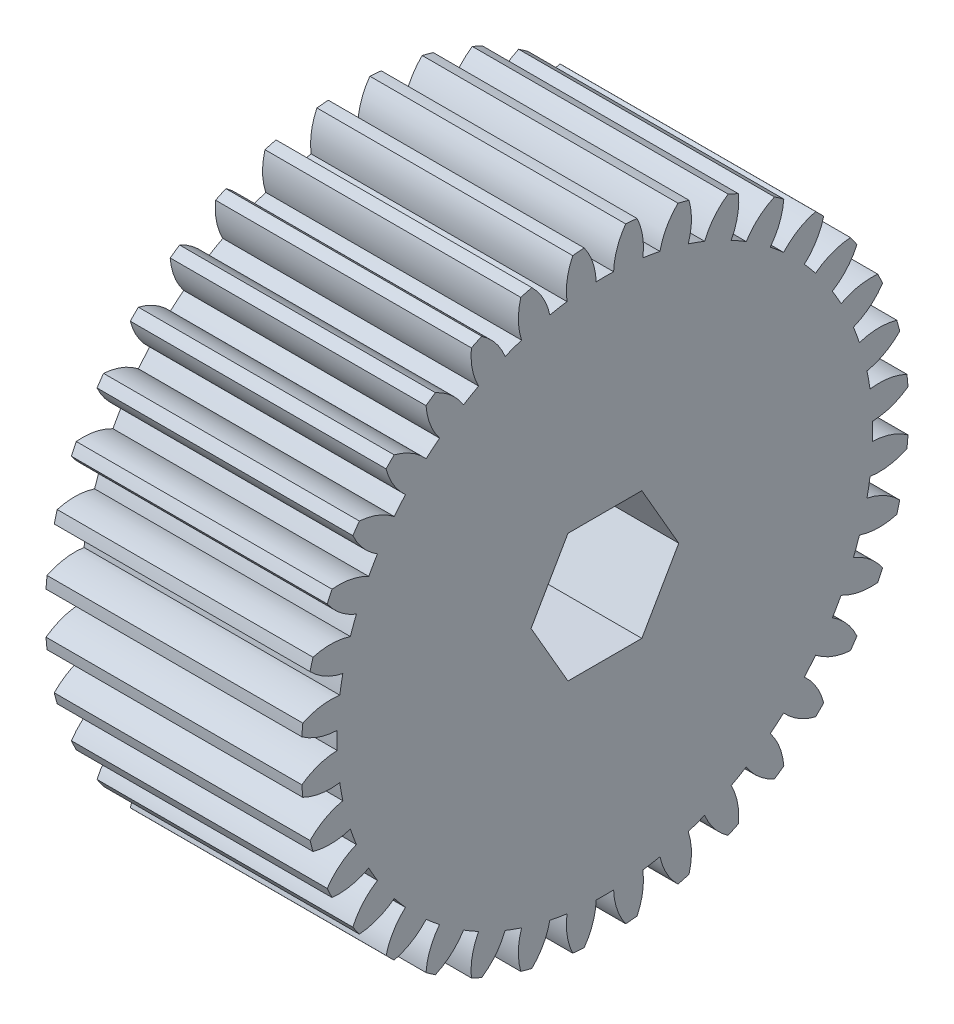
from build123d import *

# Parameters (mm, degrees)
SKETCH1_R           = 30.1625
BOSS_EXTRUDE1_DEPTH = 25.4
CUT_EXTRUDE1_DEPTH  = 50.645874073
CIRPATTERN1_COUNT   = 36
CUT_EXTRUDE2_DEPTH  = 50.560048979


with BuildPart() as part:
    # Sketch1 → Boss-Extrude1 (new body)
    with BuildSketch(Plane(origin=(0, 0, 0), x_dir=(0, 0, -1), z_dir=(1, 0, 0))):
        Circle(SKETCH1_R)
    extrude(amount=BOSS_EXTRUDE1_DEPTH)

    # Sketch2 → Cut-Extrude1 (cut, through all)
    with BuildSketch(Plane(origin=(25.4, 0, 0), x_dir=(0, 0, -1), z_dir=(1, 0, 0))):
        with BuildLine():
            ThreePointArc((-0.865646893, 26.576530875), (-1.377980861, 28.879960006), (-2.693693877, 30.838829864))
            ThreePointArc((-2.693693877, 30.838829864), (0, 30.95625), (2.693693877, 30.838829864))
            ThreePointArc((2.693693877, 30.838829864), (1.377980861, 28.879960006), (0.865646893, 26.576530875))
            ThreePointArc((0.865646893, 26.576530875), (0, 26.590625), (-0.865646893, 26.576530875))
        make_face()
    cut_extrude1 = extrude(amount=-CUT_EXTRUDE1_DEPTH, mode=Mode.SUBTRACT)

    # CirPattern1: Cut-Extrude1 ×36 about axis
    cirpattern1_axis = Axis((25.4, 0, 0), (-1, 0, 0))
    for i in range(1, CIRPATTERN1_COUNT):
        add(cut_extrude1.rotate(cirpattern1_axis, i * 360 / CIRPATTERN1_COUNT), mode=Mode.SUBTRACT)

    # Sketch3 → Cut-Extrude2 (cut, through all)
    with BuildSketch(Plane(origin=(25.4, 0, 0), x_dir=(0, 0, -1), z_dir=(1, 0, 0))):
        Polygon((3.666174209, 6.35), (-3.666174209, 6.35), (-7.332348419, 0), (-3.666174209, -6.35), (3.666174209, -6.35), (7.332348419, 0), align=None)
    extrude(amount=-CUT_EXTRUDE2_DEPTH, mode=Mode.SUBTRACT)


solid = part.part
